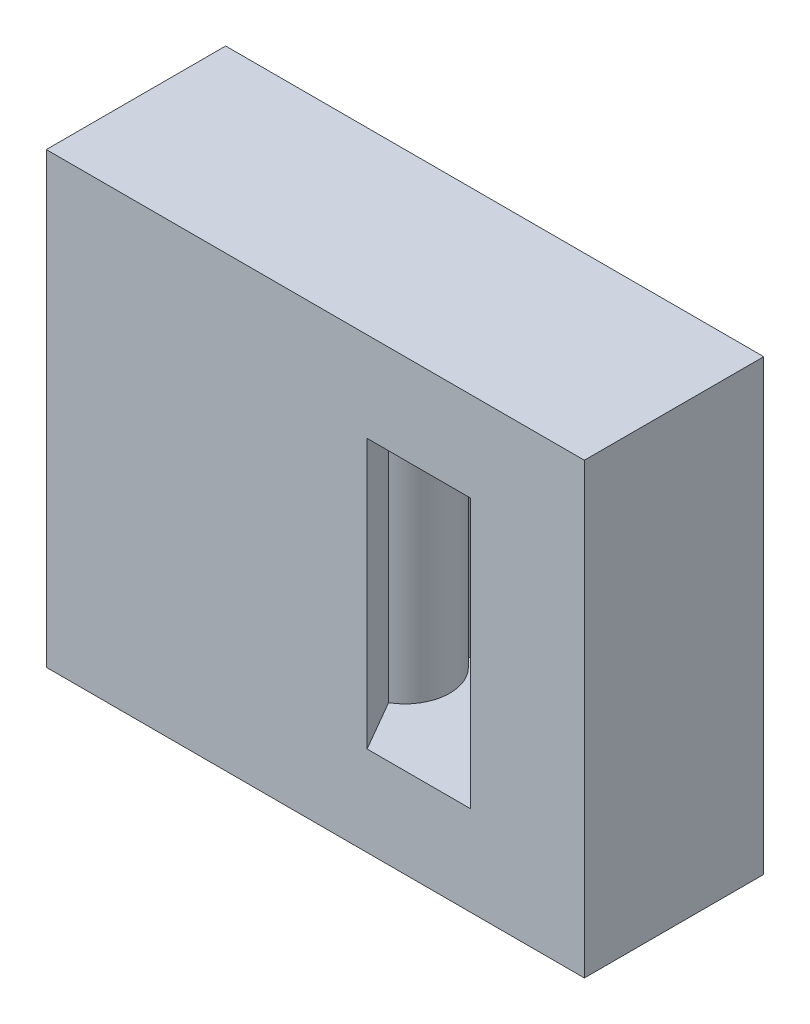
from build123d import *

# Parameters (mm, degrees)
SKETCH1_W           = 60
SKETCH1_H           = 50
BOSS_EXTRUDE1_DEPTH = 10
CUT_REVOLVE1_DEPTH  = 30


# Read off the part's stored shape, not the designer's step: Cut-Revolve1
with BuildPart() as part:
    # Sketch1 → Boss-Extrude1 (new, symmetric)
    with BuildSketch(Plane.XY):
        with Locations((0, 15)):
            Rectangle(SKETCH1_W, SKETCH1_H)
    extrude(amount=BOSS_EXTRUDE1_DEPTH, both=True)

    # Cut-Revolve1 outline → Cut-Revolve1 (cut)
    with BuildSketch(Plane(origin=(0, 0, 0), x_dir=(1, 0, 0), z_dir=(0, 1, 0))):
        with BuildLine():
            ThreePointArc((17.320508076, -10), (20, 0), (17.320508076, 10))
            Line((17.320508076, 10), (5.773502692, 10))
            Line((5.773502692, 10), (2.5, 4.330127019))
            ThreePointArc((2.5, 4.330127019), (5, 0), (2.5, -4.330127019))
            Line((2.5, -4.330127019), (5.773502692, -10))
            Line((5.773502692, -10), (17.320508076, -10))
        make_face()
    extrude(amount=CUT_REVOLVE1_DEPTH, mode=Mode.SUBTRACT)


solid = part.part
